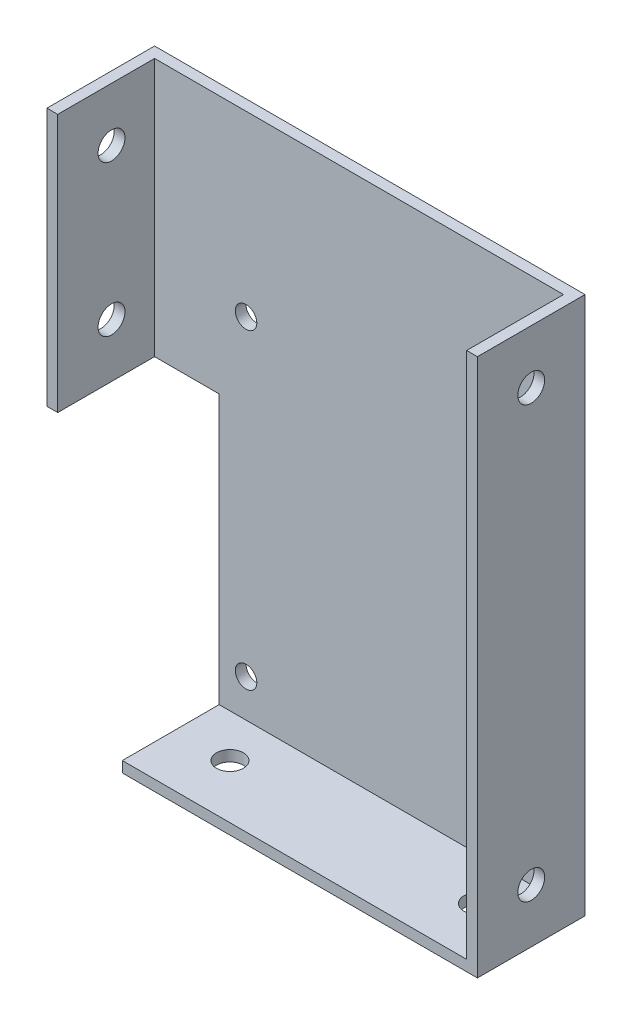
from build123d import *

# Parameters (mm, degrees)
SKETCH1_W            = 40
SKETCH1_H            = 50
BOSS_EXTRUDE1_DEPTH  = 1
SKETCH2_W            = 5
SKETCH2_H            = 25
CUT_EXTRUDE1_DEPTH   = 1
SKETCH3_W            = 1
SKETCH3_H            = 25
BOSS_EXTRUDE2_DEPTH  = 10
SKETCH4_R            = 1.25
CUT_EXTRUDE3_DEPTH   = 63
SKETCH5_R            = 1.25
BOSS_EXTRUDE3_DEPTH  = 1
SKETCH6_W            = 40
SKETCH6_H            = 10
CUT_EXTRUDE4_DEPTH   = 9
SKETCH7_R            = 1.25
CUT_EXTRUDE5_DEPTH   = 53
SKETCH8_W            = 2
SKETCH8_H            = 25
CUT_EXTRUDE6_DEPTH   = 53
SKETCH9_W            = 7
SKETCH9_H            = 2
CUT_EXTRUDE8_DEPTH   = 53
SKETCH10_W           = 9
SKETCH10_H           = 20.650485051
BOSS_EXTRUDE4_DEPTH  = 1
SKETCH11_R           = 1.25
CUT_EXTRUDE9_DEPTH   = 1
BOSS_EXTRUDE5_START  = -1
SKETCH12_R           = 1.25
BOSS_EXTRUDE5_DEPTH  = 1
SKETCH13_R           = 1.25
BOSS_EXTRUDE6_DEPTH  = 1
SKETCH14_W           = 7
SKETCH14_H           = 1
BOSS_EXTRUDE7_DEPTH  = 1
SKETCH15_W           = 1
SKETCH15_H           = 9
BOSS_EXTRUDE8_DEPTH  = 9
CUT_EXTRUDE10_START  = -9
SKETCH16_R           = 1.25
CUT_EXTRUDE10_DEPTH  = 9
SKETCH17_W           = 1
SKETCH17_H           = 31.406889679
BOSS_EXTRUDE9_DEPTH  = 9
SKETCH18_R           = 1.25
CUT_EXTRUDE11_DEPTH  = 9
SKETCH19_W           = 33
SKETCH19_H           = 1
BOSS_EXTRUDE10_DEPTH = 9
SKETCH20_R           = 1.25
CUT_EXTRUDE12_DEPTH  = 9
SKETCH21_R           = 1
CUT_EXTRUDE13_DEPTH  = 10


with BuildPart() as part:
    # Sketch1 → Boss-Extrude1 (new body)
    with BuildSketch(Plane.XY):
        with Locations((4.242424242, -5.173160173)):
            Rectangle(SKETCH1_W, SKETCH1_H)
    extrude(amount=BOSS_EXTRUDE1_DEPTH)

    # Sketch2 → Cut-Extrude1 (cut)
    with BuildSketch(Plane.XY.offset(1)):
        with Locations((-13.257575758, -17.673160173)):
            Rectangle(SKETCH2_W, SKETCH2_H)
    extrude(amount=-CUT_EXTRUDE1_DEPTH, mode=Mode.SUBTRACT)

    # Sketch3 → Boss-Extrude2 (add)
    with BuildSketch(Plane(origin=(0, 0, 0), x_dir=(-1, 0, 0), z_dir=(0, 0, -1))):
        with Locations((15.257575758, 7.326839827)):
            Rectangle(SKETCH3_W, SKETCH3_H)
        with Locations((-23.742424242, 7.326839827)):
            Rectangle(SKETCH3_W, SKETCH3_H)
    extrude(amount=-BOSS_EXTRUDE2_DEPTH)

    # Sketch4 → Cut-Extrude3 (cut)
    with BuildSketch(Plane(origin=(24.242424242, 0, 0), x_dir=(0, 0, -1), z_dir=(1, 0, 0))):
        with Locations((-5, -0.173160173)):
            Circle(SKETCH4_R)
        with Locations((-5, 14.826839827)):
            Circle(SKETCH4_R)
    extrude(amount=-CUT_EXTRUDE3_DEPTH, mode=Mode.SUBTRACT)

    # Sketch5 → Boss-Extrude3 (add)
    with BuildSketch(Plane(origin=(24.242424242, 0, 0), x_dir=(0, 0, -1), z_dir=(1, 0, 0))):
        with Locations((-5, -0.173160173)):
            Circle(SKETCH5_R)
    extrude(amount=-BOSS_EXTRUDE3_DEPTH)

    # Sketch6 → Cut-Extrude4 (cut)
    with BuildSketch(Plane.XY.offset(10)):
        with Locations((4.242424242, -0.173160173)):
            Rectangle(SKETCH6_W, SKETCH6_H)
    extrude(amount=-CUT_EXTRUDE4_DEPTH, mode=Mode.SUBTRACT)

    # Sketch7 → Cut-Extrude5 (cut)
    with BuildSketch(Plane.ZY.offset(15.757575758)):
        with Locations((5, 9.826839827)):
            Circle(SKETCH7_R)
    extrude(amount=-CUT_EXTRUDE5_DEPTH, mode=Mode.SUBTRACT)

    # Sketch8 → Cut-Extrude6 (cut)
    with BuildSketch(Plane.XY.offset(1)):
        with Locations((-9.757575758, -17.673160173)):
            Rectangle(SKETCH8_W, SKETCH8_H)
    extrude(amount=-CUT_EXTRUDE6_DEPTH, mode=Mode.SUBTRACT)

    # Sketch9 → Cut-Extrude8 (cut)
    with BuildSketch(Plane.XY.offset(1)):
        with Locations((-12.257575758, -4.173160173)):
            Rectangle(SKETCH9_W, SKETCH9_H)
    extrude(amount=-CUT_EXTRUDE8_DEPTH, mode=Mode.SUBTRACT)

    # Sketch10 → Boss-Extrude4 (add)
    with BuildSketch(Plane(origin=(24.242424242, 0, 0), x_dir=(0, 0, -1), z_dir=(1, 0, 0))):
        with Locations((-5.5, -5.498402699)):
            Rectangle(SKETCH10_W, SKETCH10_H)
    extrude(amount=-BOSS_EXTRUDE4_DEPTH)

    # Sketch11 → Cut-Extrude9 (cut)
    with BuildSketch(Plane(origin=(24.242424242, 0, 0), x_dir=(0, 0, -1), z_dir=(1, 0, 0))):
        with Locations((-5, -10.823645224)):
            Circle(SKETCH11_R)
    extrude(amount=-CUT_EXTRUDE9_DEPTH, mode=Mode.SUBTRACT)

    # Sketch12 → Boss-Extrude5 (add)
    with BuildSketch(Plane(origin=(24.242424242, 0, 0), x_dir=(0, 0, -1), z_dir=(1, 0, 0)).offset(BOSS_EXTRUDE5_START)):
        with Locations((-5, 9.826839827)):
            Circle(SKETCH12_R)
    extrude(amount=BOSS_EXTRUDE5_DEPTH)

    # Sketch13 → Boss-Extrude6 (add)
    with BuildSketch(Plane.ZY.offset(15.757575758)):
        with Locations((5, 9.826839827)):
            Circle(SKETCH13_R)
    extrude(amount=-BOSS_EXTRUDE6_DEPTH)

    # Sketch14 → Boss-Extrude7 (add)
    with BuildSketch(Plane.XY.offset(1)):
        with Locations((-12.257575758, -3.673160173)):
            Rectangle(SKETCH14_W, SKETCH14_H)
    extrude(amount=-BOSS_EXTRUDE7_DEPTH)

    # Sketch15 → Boss-Extrude8 (add)
    with BuildSketch(Plane.XY.offset(1)):
        with Locations((-15.257575758, 0.326839827)):
            Rectangle(SKETCH15_W, SKETCH15_H)
    extrude(amount=BOSS_EXTRUDE8_DEPTH)

    # Sketch16 → Cut-Extrude10 (cut)
    with BuildSketch(Plane.ZY.offset(15.757575758).offset(CUT_EXTRUDE10_START)):
        with Locations((5, 14.826839827)):
            Circle(SKETCH16_R)
        with Locations((5, 0.826839827)):
            Circle(SKETCH16_R)
    extrude(amount=CUT_EXTRUDE10_DEPTH, mode=Mode.SUBTRACT)

    # Sketch17 → Boss-Extrude9 (add)
    with BuildSketch(Plane.XY.offset(1)):
        with Locations((23.742424242, -14.469715334)):
            Rectangle(SKETCH17_W, SKETCH17_H)
    extrude(amount=BOSS_EXTRUDE9_DEPTH)

    # Sketch18 → Cut-Extrude11 (cut)
    with BuildSketch(Plane(origin=(24.242424242, 0, 0), x_dir=(0, 0, -1), z_dir=(1, 0, 0))):
        with Locations((-5, -25.173160173)):
            Circle(SKETCH18_R)
    extrude(amount=-CUT_EXTRUDE11_DEPTH, mode=Mode.SUBTRACT)

    # Sketch19 → Boss-Extrude10 (add)
    with BuildSketch(Plane.XY.offset(1)):
        with Locations((7.742424242, -29.673160173)):
            Rectangle(SKETCH19_W, SKETCH19_H)
    extrude(amount=BOSS_EXTRUDE10_DEPTH)

    # Sketch20 → Cut-Extrude12 (cut)
    with BuildSketch(Plane.XZ.offset(30.173160173)):
        with Locations((-3.757575758, 5)):
            Circle(SKETCH20_R)
        with Locations((19.242424242, 5)):
            Circle(SKETCH20_R)
    extrude(amount=-CUT_EXTRUDE12_DEPTH, mode=Mode.SUBTRACT)

    # Sketch21 → Cut-Extrude13 (cut)
    with BuildSketch(Plane(origin=(0, 0, 0), x_dir=(-1, 0, 0), z_dir=(0, 0, -1))):
        with Locations((-21.742424242, 3.326839827)):
            Circle(SKETCH21_R)
        with Locations((6.257575758, 3.27845273)):
            Circle(SKETCH21_R)
        with Locations((6.257575758, -25.673160173)):
            Circle(SKETCH21_R)
        with Locations((-21.742424242, -25.673160173)):
            Circle(SKETCH21_R)
    extrude(amount=-CUT_EXTRUDE13_DEPTH, mode=Mode.SUBTRACT)


solid = part.part
